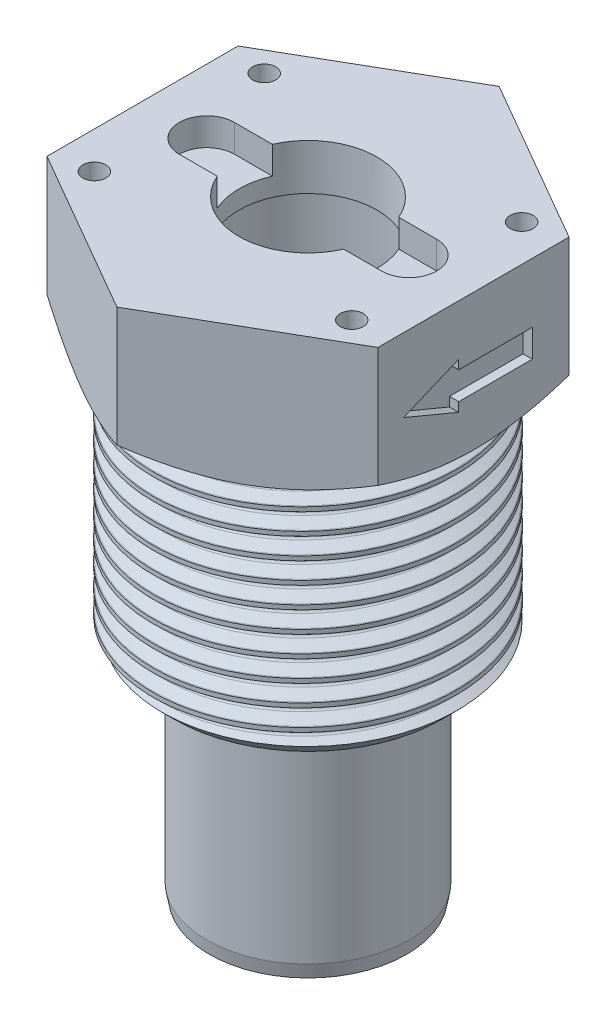
from build123d import *

# Parameters (mm, degrees)
SKETCH_1_W             = 11
SKETCH_1_H             = 65
SKETCH_8_R             = 18.027171515
CUT_EXTRUDE_8_DEPTH    = 2
SKETCH_10_R            = 9.5
CUT_EXTRUDE_10_DEPTH   = 58
SKETCH_11_R            = 7.5
CUT_EXTRUDE_11_DEPTH   = 6
SKETCH_25_R            = 9.5
EXTRUDE_4_DEPTH        = 15
WRAP_START             = -33
WRAP_1_DEPTH           = 1
SKETCH_20_R            = 16.5
SKETCH_20_R_2          = 11
EXTRUDE_3_DEPTH        = 27
CHAMFER_1_SIZE         = 2
SWEEP_2_PITCH          = 2.309
CUT_EXTRUDE_12_DEPTH   = 3
HOLE_WIZARD_M3_1_D     = 2.5
HOLE_WIZARD_M3_1_DEPTH = 10.5
HOLE_WIZARD_M3_1_TIP   = 0.751075774
SKETCH_30_R            = 11
SKETCH_30_R_2          = 10.4
EXTRUDE_5_DEPTH        = 3
CHAMFER_2_SIZE         = 1.5
CHAMFER_2_SIZE_2       = 0.264490471


with BuildPart() as part:
    # 草图1 → 旋转1 (revolve)
    with BuildSketch(Plane.XY, mode=Mode.PRIVATE) as revolve_1_sk:
        with Locations((5.5, 32.5)):
            Rectangle(SKETCH_1_W, SKETCH_1_H)
    revolve(revolve_1_sk.sketch.rotate(Axis((0, 65, 0), (0, -1, 0)), 180), axis=Axis((0, 65, 0), (0, -1, 0)))

    # 草图8 → 切除-拉伸8 (cut)
    with BuildSketch(Plane.XZ):
        Circle(SKETCH_8_R)
    extrude(amount=-CUT_EXTRUDE_8_DEPTH, mode=Mode.SUBTRACT)

    # 草图10 → 切除-拉伸10 (cut)
    with BuildSketch(Plane.XZ.offset(-2)):
        Circle(SKETCH_10_R)
    extrude(amount=-CUT_EXTRUDE_10_DEPTH, mode=Mode.SUBTRACT)

    # 草图11 → 切除-拉伸11 (cut)
    with BuildSketch(Plane(origin=(0, 65, 0), x_dir=(1, 0, 0), z_dir=(0, 1, 0))):
        with Locations(Location((0, 0, 0), (0, 0, 180))):
            Circle(SKETCH_11_R)
    extrude(amount=-CUT_EXTRUDE_11_DEPTH, mode=Mode.SUBTRACT)

    # 草图25 → 凸台-拉伸4 (add)
    with BuildSketch(Plane(origin=(0, 50, 0), x_dir=(1, 0, 0), z_dir=(0, 1, 0))):
        Polygon((0, 20.784609691), (-18, 10.392304845), (-18, -10.392304845), (0, -20.784609691), (18, -10.392304845), (18, 10.392304845), align=None)
        Circle(SKETCH_25_R, mode=Mode.SUBTRACT)
    extrude(amount=EXTRUDE_4_DEPTH)

    # 包覆1: read off the stored shape, not the designer's step
    # 包覆1 outline → 包覆1 (cut)
    with BuildSketch(Plane(origin=(50, 0, 0), x_dir=(0, 0, -1), z_dir=(1, 0, 0)).offset(WRAP_START)):
        Polygon((-7.607695155, 57), (-1.607695155, 54.5), (-1.607695155, 55.5), (6.392304845, 55.5), (6.392304845, 58.5), (-1.607695155, 58.5), (-1.607695155, 59.5), align=None)
    wrap_1 = extrude(amount=WRAP_1_DEPTH, mode=Mode.SUBTRACT)

    # 镜向1: 包覆1 across plane
    add(wrap_1.mirror(Plane(origin=(0, 0, 0), x_dir=(0, 0, 1), z_dir=(1, 0, 0))), mode=Mode.SUBTRACT)

    # 草图20 → 凸台-拉伸3 (add)
    with BuildSketch(Plane(origin=(0, 50, 0), x_dir=(1, 0, 0), z_dir=(0, 1, 0))):
        with Locations(Location((0, 0, 0), (0, 0, 270))):
            Circle(SKETCH_20_R)
        with Locations(Location((0, 0, 0), (0, 0, 270))):
            Circle(SKETCH_20_R_2, mode=Mode.SUBTRACT)
    extrude(amount=-EXTRUDE_3_DEPTH)

    # 草图21 → 切除-旋转2 (revolve, cut)
    with BuildSketch(Plane(origin=(0, 0, 0), x_dir=(0, 0, -1), z_dir=(1, 0, 0)), mode=Mode.PRIVATE) as cut_revolve_2_sk:
        Polygon((20.784609691, 52), (20.784609691, 50), (17.784609691, 50), align=None)
    revolve(cut_revolve_2_sk.sketch.rotate(Axis((0, 52, 0), (0, 1, 0)), 180), axis=Axis((0, 52, 0), (0, 1, 0)), mode=Mode.SUBTRACT)

    # 倒角1
    chamfer_1_edges = [part.edges().sort_by_distance(p)[0] for p in [
        (0, 23, -16.5),
    ]]
    chamfer(chamfer_1_edges, length=CHAMFER_1_SIZE)

    # 切除-扫描2: arcs per turn and ends read off the stored shape
    # 切除-扫描2: the profile of 草图24 screwed along a right-hand helix through 12 turns, 10 arcs to a turn; built about Z, then put on its axis
    sweep_2_z = Axis((0, 0, 0), (0, 0, 1))
    sweep_2_corners = [(16.42937431, 0, -0.590182434), (15.292853797, 0, -1.181817566), (15.122228107, 0, -1.463), (15.292853797, 0, -1.744182434), (16.42937431, 0, -2.335817566), (16.6, 0, -2.617), (16.6, 0, -0.309)]
    with BuildLine(mode=Mode.PRIVATE) as sweep_2_profile:
        Line(sweep_2_corners[0], sweep_2_corners[1])
        Line(sweep_2_corners[3], sweep_2_corners[4])
        Line(sweep_2_corners[5], sweep_2_corners[6])
        ThreePointArc((15.292853797, 0, -1.181817566), (15.168221044, 0, -1.298548877), (15.122228107, 0, -1.463))
        ThreePointArc((15.122228107, 0, -1.463), (15.168221044, 0, -1.627451123), (15.292853797, 0, -1.744182434))
        ThreePointArc((16.42937431, 0, -2.335817566), (16.554007063, 0, -2.452548877), (16.6, 0, -2.617))
        ThreePointArc((16.6, 0, -0.309), (16.554007063, 0, -0.473451123), (16.42937431, 0, -0.590182434))
    sweep_2_cap = Face(sweep_2_profile.wire())
    sweep_2_arcs = [((15.292853797, 0, -1.181817566), (15.122228107, 0, -1.270639678), (15.122228107, 0, -1.463), (1, 0.854911870672946, 1)), ((15.122228107, 0, -1.463), (15.122228107, 0, -1.655360322), (15.292853797, 0, -1.744182434), (1, 0.854911870672946, 1)), ((16.42937431, 0, -2.335817566), (16.6, 0, -2.424639678), (16.6, 0, -2.617), (1, 0.8549118706729456, 1)), ((16.6, 0, -0.309), (16.6, 0, -0.501360322), (16.42937431, 0, -0.590182434), (1, 0.8549118706729619, 1))]  # start, shoulder, end, weights
    sweep_2_turn_angles = [0, 18, 36, 54, 72, 90, 108, 126, 144, 162, 180, 198, 216, 234, 252, 270, 288, 306, 324, 342, 360]
    sweep_2_turn_weights = [1, 0.9510565162951535, 1, 0.9510565162951535, 1, 0.9510565162951535, 1, 0.9510565162951535, 1, 0.9510565162951535, 1, 0.9510565162951535, 1, 0.9510565162951535, 1, 0.9510565162951535, 1, 0.9510565162951535, 1, 0.9510565162951535, 1]
    sweep_2_turn_rails = [Edge.make_bspline([Vector(p[0], p[1], 0).rotate(sweep_2_z, sweep_2_turn_angles[k]) / sweep_2_turn_weights[k] + Vector(0, 0, p[2] + SWEEP_2_PITCH * sweep_2_turn_angles[k] / 360) for k in range(21)], [0, 0, 0, 1, 1, 2, 2, 3, 3, 4, 4, 5, 5, 6, 6, 7, 7, 8, 8, 9, 9, 10, 10, 10], 2, sweep_2_turn_weights) for p in sweep_2_corners]
    sweep_2_turn_sides = [*[Face.make_surface_from_curves(sweep_2_turn_rails[p[0]], sweep_2_turn_rails[p[1]]) for p in [(0, 1), (3, 4), (5, 6)]], *[Face.make_bezier_surface([[Vector(p[j][0], p[j][1], 0).rotate(sweep_2_z, sweep_2_turn_angles[2 * i + k]) / sweep_2_turn_weights[2 * i + k] + Vector(0, 0, p[j][2] + SWEEP_2_PITCH * sweep_2_turn_angles[2 * i + k] / 360) for k in range(3)] for j in range(3)], [[p[3][j] * sweep_2_turn_weights[2 * i + k] for k in range(3)] for j in range(3)]) for p in sweep_2_arcs for i in range(10)]]
    sweep_2 = Plane(origin=(0, 23, 0), x_dir=(0, 0, -1), z_dir=(0, 1, 0)) * Solid(Shell([*[p.moved(Location((0, 0, SWEEP_2_PITCH * i))) for i in range(12) for p in sweep_2_turn_sides], sweep_2_cap, sweep_2_cap.rotate(sweep_2_z, 4320).moved(Location((0, 0, SWEEP_2_PITCH * 4320 / 360)))]))
    add(sweep_2, mode=Mode.SUBTRACT)

    # 草图27 → 切除-拉伸12 (cut)
    with BuildSketch(Plane(origin=(0, 65, 0), x_dir=(1, 0, 0), z_dir=(0, 1, 0))):
        with BuildLine():
            Line((-11, 3), (11, 3))
            ThreePointArc((11, 3), (14, 0), (11, -3))
            Line((11, -3), (-11, -3))
            ThreePointArc((-11, -3), (-14, 0), (-11, 3))
        make_face()
    extrude(amount=-CUT_EXTRUDE_12_DEPTH, mode=Mode.SUBTRACT)

    # M3 螺纹孔1
    with Locations(Plane(origin=(0, 65, 0), x_dir=(1, 0, 0), z_dir=(0, 1, 0))):
        with Locations((-14, 9.237604307), (-14, -9.237604307), (14, -9.237604307), (14, 9.237604307)):
            Hole(HOLE_WIZARD_M3_1_D / 2, depth=HOLE_WIZARD_M3_1_DEPTH)
            with Locations((0, 0, -(HOLE_WIZARD_M3_1_DEPTH + HOLE_WIZARD_M3_1_TIP / 2))):  # 118° drill point
                Cone(0, HOLE_WIZARD_M3_1_D / 2, HOLE_WIZARD_M3_1_TIP, mode=Mode.SUBTRACT)

    # 草图30 → 凸台-拉伸5 (add)
    with BuildSketch(Plane.XZ.offset(-2)):
        with Locations(Location((0, 0, 0), (0, 0, 90))):
            Circle(SKETCH_30_R)
        Circle(SKETCH_30_R_2, mode=Mode.SUBTRACT)
    extrude(amount=EXTRUDE_5_DEPTH)

    # 倒角2
    # the kernel refuses this chamfer: 1.5, 0.264490471 mm, written as the material it takes off along each edge
    with BuildSketch(Plane(origin=(0, -1, 0), x_dir=(0, 0, 1), z_dir=(1, 0, 0))) as chamfer_2_piece_1:
        Polygon((11, -CHAMFER_2_SIZE), (11 - CHAMFER_2_SIZE_2, 0), (11, 0), align=None)
    revolve(axis=Axis((0, -1, 0), (0, -1, 0)), mode=Mode.SUBTRACT)


solid = part.part
